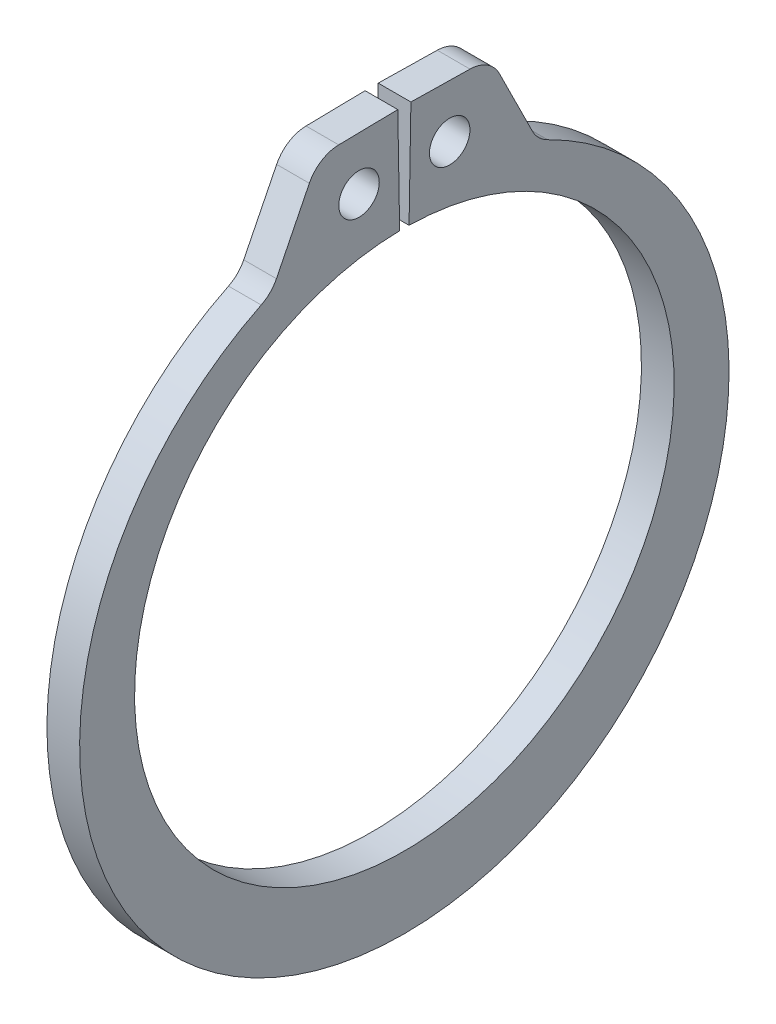
from build123d import *

# Parameters (mm, degrees)
SKETCH1_R      = 0.6604
EXTRUDE1_DEPTH = 0.5334
FILLET1_R      = 1.0922


with BuildPart() as part:
    # Sketch1 → Extrude1 (new, symmetric)
    with BuildSketch(Plane(origin=(0, 0, 0), x_dir=(0, 0, -1), z_dir=(1, 0, 0))):
        with BuildLine():
            Line((-0.153600374, 8.79975955), (-0.213887967, 12.253633428))
            Line((-0.213887967, 12.253633428), (-2.804293376, 12.208417733))
            Line((-2.804293376, 12.208417733), (-4.342027289, 9.115158324))
            ThreePointArc((-4.342027289, 9.115158324), (0, -11.1379), (4.342027289, 9.115158324))
            Line((4.342027289, 9.115158324), (2.804293376, 12.208417733))
            Line((2.804293376, 12.208417733), (0.213887967, 12.253633428))
            Line((0.213887967, 12.253633428), (0.153600374, 8.79975955))
            ThreePointArc((0.153600374, 8.79975955), (0, -8.8011), (-0.153600374, 8.79975955))
        make_face()
        with Locations((-1.478946875, 10.504088642)):
            Circle(SKETCH1_R, mode=Mode.SUBTRACT)
        with Locations((1.478946875, 10.504088642)):
            Circle(SKETCH1_R, mode=Mode.SUBTRACT)
    extrude(amount=EXTRUDE1_DEPTH, both=True)

    # Fillet1
    fillet1_edges = [part.edges().sort_by_distance(p)[0] for p in [
        (0, 9.115158324, 4.342027289),
        (0, 9.115158324, -4.342027289),
        (0, 12.208417733, 2.804293376),
        (0, 12.208417733, -2.804293376),
    ]]
    fillet(fillet1_edges, radius=FILLET1_R)


solid = part.part
